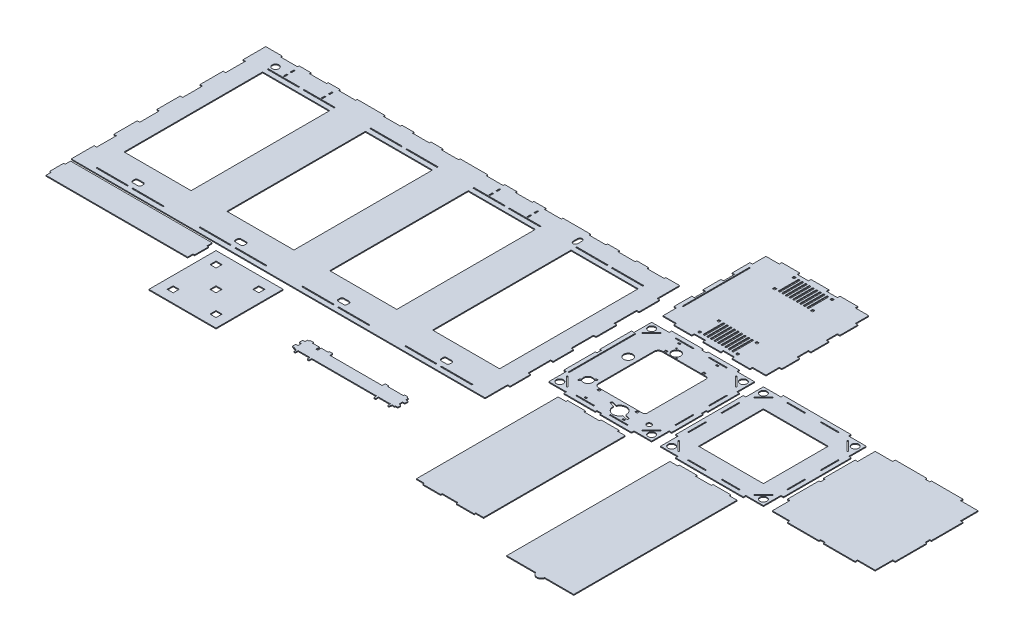
from build123d import *

# Parameters (mm, degrees)
BOSS_EXTRUDE1_DEPTH   = 2.54
SKETCH5_R             = 9.525
SKETCH5_W             = 190.5
SKETCH5_H             = 3.1242
SKETCH5_H_2           = 393.7
CUT_EXTRUDE2_DEPTH    = 788.40676989
BOSS_EXTRUDE2_DEPTH   = 2.54
SKETCH6_W             = 184.15
SKETCH6_H             = 184.15
BOSS_EXTRUDE2_2_DEPTH = 2.54
BOSS_EXTRUDE2_3_DEPTH = 2.54
BOSS_EXTRUDE3_DEPTH   = 2.54
SKETCH8_R             = 10
CUT_EXTRUDE3_DEPTH    = 1467.151394116
SKETCH9_W             = 190.5
SKETCH9_H             = 190.5
SKETCH9_W_2           = 17.272
SKETCH9_H_2           = 17.272
BOSS_EXTRUDE4_DEPTH   = 2.54
SKETCH11_R            = 12.6875032
SKETCH11_R_2          = 1.7054957
SKETCH11_R_3          = 6.747379022
CUT_EXTRUDE4_DEPTH    = 1505.09366579
SKETCH12_W            = 2.921
SKETCH12_H            = 50.8
SKETCH12_W_2          = 50.8
SKETCH12_H_2          = 2.921
CUT_EXTRUDE5_DEPTH    = 1505.09366579
SKETCH13_W            = 2.921
SKETCH13_H            = 190.5
CUT_EXTRUDE6_DEPTH    = 1505.09366579
BOSS_EXTRUDE5_DEPTH   = 2.54
SKETCH14_W            = 2.921
SKETCH14_H            = 190.5
BOSS_EXTRUDE5_2_DEPTH = 2.54
BOSS_EXTRUDE5_3_DEPTH = 2.54
SKETCH15_W            = 48.387
SKETCH15_H            = 4.445
CUT_EXTRUDE7_DEPTH    = 1562.96270761
SKETCH16_W            = 12.7
SKETCH16_H            = 3.1242
BOSS_EXTRUDE6_DEPTH   = 2.54
SKETCH17_W            = 13.335
SKETCH17_H            = 4.445
SKETCH17_W_2          = 4.445
SKETCH17_H_2          = 13.335
CUT_EXTRUDE8_DEPTH    = 1562.96270761
BOSS_EXTRUDE7_DEPTH   = 2.54
CUT_EXTRUDE9_DEPTH    = 1562.96270761
SKETCH21_W            = 6.35
SKETCH21_H            = 6.35
SKETCH21_H_2          = 6.393751892
CUT_EXTRUDE10_DEPTH   = 1562.96270761
SKETCH22_W            = 3.556
SKETCH22_H            = 10
CUT_EXTRUDE11_DEPTH   = 1562.96270761


with BuildPart() as part:
    # Sketch1 → Boss-Extrude1 (new body)
    with BuildSketch(Plane(origin=(0, 0, 0), x_dir=(1, 0, 0), z_dir=(0, 1, 0))):
        Polygon((146.05, 276.225), (438.15, 276.225), (438.15, 212.3694), (445.262, 212.3694), (445.262, 154.0764), (438.15, 154.0764), (438.15, 90.2208), (445.262, 90.2208), (445.262, 31.9278), (438.15, 31.9278), (438.15, -31.9278), (445.262, -31.9278), (445.262, -90.2208), (438.15, -90.2208), (438.15, -154.0764), (445.262, -154.0764), (445.262, -212.3694), (438.15, -212.3694), (438.15, -276.225), (146.05, -276.225), (-146.05, -276.225), (-438.15, -276.225), (-730.25, -276.225), (-737.362, -276.225), (-737.362, -211.1629), (-730.25, -211.1629), (-730.25, -155.2829), (-737.362, -155.2829), (-737.362, -89.0143), (-730.25, -89.0143), (-730.25, -33.1343), (-737.362, -33.1343), (-737.362, 33.1343), (-730.25, 33.1343), (-730.25, 89.0143), (-737.362, 89.0143), (-737.362, 155.2829), (-730.25, 155.2829), (-730.25, 211.1629), (-737.362, 211.1629), (-737.362, 276.225), (-730.25, 276.225), (-438.15, 276.225), (-146.05, 276.225), align=None)
    extrude(amount=BOSS_EXTRUDE1_DEPTH)

    # Sketch5 → Cut-Extrude2 (cut, through all)
    with BuildSketch(Plane(origin=(0, 2.54, 0), x_dir=(1, 0, 0), z_dir=(0, 1, 0))):
        with Locations((-673.862, 240.5634)):
            Circle(SKETCH5_R)
        with Locations((-584.2, -261.9629)):
            Rectangle(SKETCH5_W, SKETCH5_H)
        with Locations((-292.1, -261.9629)):
            Rectangle(SKETCH5_W, SKETCH5_H)
        with Locations((0, -261.9629)):
            Rectangle(SKETCH5_W, SKETCH5_H)
        with Locations((292.1, -261.9629)):
            Rectangle(SKETCH5_W, SKETCH5_H)
        with Locations((-584.2, 12.6492)):
            Rectangle(SKETCH5_W, SKETCH5_H_2)
        with Locations((-292.1, 12.6492)):
            Rectangle(SKETCH5_W, SKETCH5_H_2)
        with Locations((0, 12.6492)):
            Rectangle(SKETCH5_W, SKETCH5_H_2)
        with Locations((292.1, 12.6492)):
            Rectangle(SKETCH5_W, SKETCH5_H_2)
        with Locations((-584.2, 223.7613)):
            Rectangle(SKETCH5_W, SKETCH5_H)
        with Locations((-292.1, 223.7613)):
            Rectangle(SKETCH5_W, SKETCH5_H)
        with Locations((0, 223.7613)):
            Rectangle(SKETCH5_W, SKETCH5_H)
        with Locations((292.1, 223.7613)):
            Rectangle(SKETCH5_W, SKETCH5_H)
        with BuildLine():
            Line((-7.62, -247.7008), (7.62, -247.7008))
            ThreePointArc((7.62, -247.7008), (11.212102448, -246.212902448), (12.7, -242.6208))
            Line((12.7, -242.6208), (12.7, -236.9058))
            ThreePointArc((12.7, -236.9058), (11.212102448, -233.313697552), (7.62, -231.8258))
            Line((7.62, -231.8258), (-7.62, -231.8258))
            ThreePointArc((-7.62, -231.8258), (-11.212102448, -233.313697552), (-12.7, -236.9058))
            Line((-12.7, -236.9058), (-12.7, -242.6208))
            ThreePointArc((-12.7, -242.6208), (-11.212102448, -246.212902448), (-7.62, -247.7008))
        make_face()
        with BuildLine():
            Line((-299.72, -231.8258), (-284.48, -231.8258))
            ThreePointArc((-284.48, -231.8258), (-280.887897552, -233.313697552), (-279.4, -236.9058))
            Line((-279.4, -236.9058), (-279.4, -242.6208))
            ThreePointArc((-279.4, -242.6208), (-280.887897552, -246.212902448), (-284.48, -247.7008))
            Line((-284.48, -247.7008), (-299.72, -247.7008))
            ThreePointArc((-299.72, -247.7008), (-303.312102448, -246.212902448), (-304.8, -242.6208))
            Line((-304.8, -242.6208), (-304.8, -236.9058))
            ThreePointArc((-304.8, -236.9058), (-303.312102448, -233.313697552), (-299.72, -231.8258))
        make_face()
        with BuildLine():
            Line((284.48, -247.7008), (299.72, -247.7008))
            ThreePointArc((299.72, -247.7008), (303.312102448, -246.212902448), (304.8, -242.6208))
            Line((304.8, -242.6208), (304.8, -236.9058))
            ThreePointArc((304.8, -236.9058), (303.312102448, -233.313697552), (299.72, -231.8258))
            Line((299.72, -231.8258), (284.48, -231.8258))
            ThreePointArc((284.48, -231.8258), (280.887897552, -233.313697552), (279.4, -236.9058))
            Line((279.4, -236.9058), (279.4, -242.6208))
            ThreePointArc((279.4, -242.6208), (280.887897552, -246.212902448), (284.48, -247.7008))
        make_face()
        with BuildLine():
            Line((-596.9, -236.9058), (-596.9, -242.6208))
            ThreePointArc((-596.9, -242.6208), (-595.412102448, -246.212902448), (-591.82, -247.7008))
            Line((-591.82, -247.7008), (-576.58, -247.7008))
            ThreePointArc((-576.58, -247.7008), (-572.987897552, -246.212902448), (-571.5, -242.6208))
            Line((-571.5, -242.6208), (-571.5, -236.9058))
            ThreePointArc((-571.5, -236.9058), (-572.987897552, -233.313697552), (-576.58, -231.8258))
            Line((-576.58, -231.8258), (-591.82, -231.8258))
            ThreePointArc((-591.82, -231.8258), (-595.412102448, -233.313697552), (-596.9, -236.9058))
        make_face()
        with BuildLine():
            Line((190.5, 246.9134), (190.5, 234.2134))
            ThreePointArc((190.5, 234.2134), (184.15, 227.8634), (177.8, 234.2134))
            Line((177.8, 234.2134), (177.8, 246.9134))
            ThreePointArc((177.8, 246.9134), (184.15, 253.2634), (190.5, 246.9134))
        make_face()
    extrude(amount=-CUT_EXTRUDE2_DEPTH, mode=Mode.SUBTRACT)

    # Sketch15 → Cut-Extrude7 (cut, through all)
    with BuildSketch(Plane(origin=(0, 2.54, 0), x_dir=(1, 0, 0), z_dir=(0, 1, 0))):
        with Locations((209.55, 274.0025)):
            Rectangle(SKETCH15_W, SKETCH15_H)
        with Locations((374.65, 274.0025)):
            Rectangle(SKETCH15_W, SKETCH15_H)
        with Locations((-82.55, 274.0025)):
            Rectangle(SKETCH15_W, SKETCH15_H)
        with Locations((82.55, 274.0025)):
            Rectangle(SKETCH15_W, SKETCH15_H)
        with Locations((-374.65, 274.0025)):
            Rectangle(SKETCH15_W, SKETCH15_H)
        with Locations((-209.55, 274.0025)):
            Rectangle(SKETCH15_W, SKETCH15_H)
        with Locations((-666.75, 274.0025)):
            Rectangle(SKETCH15_W, SKETCH15_H)
        with Locations((-501.65, 274.0025)):
            Rectangle(SKETCH15_W, SKETCH15_H)
        with Locations((292.1, 274.0025)):
            Rectangle(SKETCH15_W, SKETCH15_H)
        with Locations((0, 274.0025)):
            Rectangle(SKETCH15_W, SKETCH15_H)
        with Locations((-584.2, 274.0025)):
            Rectangle(SKETCH15_W, SKETCH15_H)
        with Locations((-292.1, 274.0025)):
            Rectangle(SKETCH15_W, SKETCH15_H)
    extrude(amount=-CUT_EXTRUDE7_DEPTH, mode=Mode.SUBTRACT)

    # Sketch16 → Boss-Extrude6 (add)
    with BuildSketch(Plane(origin=(0, 2.54, 0), x_dir=(1, 0, 0), z_dir=(0, 1, 0))):
        with Locations((-584.2, 223.7613)):
            Rectangle(SKETCH16_W, SKETCH16_H)
        with Locations((-292.1, 223.7613)):
            Rectangle(SKETCH16_W, SKETCH16_H)
        with Locations((-584.2, -261.9629)):
            Rectangle(SKETCH16_W, SKETCH16_H)
        with Locations((-292.1, -261.9629)):
            Rectangle(SKETCH16_W, SKETCH16_H)
        with Locations((0, 223.7613)):
            Rectangle(SKETCH16_W, SKETCH16_H)
        with Locations((0, -261.9629)):
            Rectangle(SKETCH16_W, SKETCH16_H)
        with Locations((292.1, 223.7613)):
            Rectangle(SKETCH16_W, SKETCH16_H)
        with Locations((292.1, -261.9629)):
            Rectangle(SKETCH16_W, SKETCH16_H)
    extrude(amount=-BOSS_EXTRUDE6_DEPTH)

    # Sketch22 → Cut-Extrude11 (cut, through all)
    with BuildSketch(Plane(origin=(0, 2.54, 0), x_dir=(1, 0, 0), z_dir=(0, 1, 0))):
        with Locations((-638.175, 253.498399878)):
            Rectangle(SKETCH22_W, SKETCH22_H)
        with Locations((-638.175, 233.4984)):
            Rectangle(SKETCH22_W, SKETCH22_H)
        with Locations((-530.225, 233.4984)):
            Rectangle(SKETCH22_W, SKETCH22_H)
        with Locations((-530.225, 253.498399878)):
            Rectangle(SKETCH22_W, SKETCH22_H)
        with Locations((-53.975, 253.498399878)):
            Rectangle(SKETCH22_W, SKETCH22_H)
        with Locations((-53.975, 233.4984)):
            Rectangle(SKETCH22_W, SKETCH22_H)
        with Locations((53.975, 253.498399878)):
            Rectangle(SKETCH22_W, SKETCH22_H)
        with Locations((53.975, 233.4984)):
            Rectangle(SKETCH22_W, SKETCH22_H)
    extrude(amount=-CUT_EXTRUDE11_DEPTH, mode=Mode.SUBTRACT)


with BuildPart() as body_2:
    # Sketch6 → Boss-Extrude2 (new body)
    with BuildSketch(Plane(origin=(0, 0, 0), x_dir=(1, 0, 0), z_dir=(0, 1, 0))):
        Polygon((488.95, 96.139), (488.95, 146.05), (538.861, 146.05), (538.861, 153.162), (731.139, 153.162), (731.139, 146.05), (781.05, 146.05), (781.05, 96.139), (788.162, 96.139), (788.162, -96.139), (781.05, -96.139), (781.05, -146.05), (731.139, -146.05), (731.139, -153.162), (538.861, -153.162), (538.861, -146.05), (488.95, -146.05), (488.95, -96.139), (481.838, -96.139), (481.838, 96.139), align=None)
    extrude(amount=BOSS_EXTRUDE2_DEPTH)


with BuildPart() as body_3:
    # Sketch6 → Boss-Extrude2 2 (new body)
    with BuildSketch(Plane(origin=(0, 0, 0), x_dir=(1, 0, 0), z_dir=(0, 1, 0))):
        Polygon((799.338, 96.139), (799.338, -96.139), (806.45, -96.139), (806.45, -146.05), (856.361, -146.05), (856.361, -153.162), (1048.639, -153.162), (1048.639, -146.05), (1098.55, -146.05), (1098.55, -96.139), (1105.662, -96.139), (1105.662, 96.139), (1098.55, 96.139), (1098.55, 146.05), (1048.639, 146.05), (1048.639, 153.162), (856.361, 153.162), (856.361, 146.05), (806.45, 146.05), (806.45, 96.139), align=None)
        with Locations((952.5, 0)):
            Rectangle(SKETCH6_W, SKETCH6_H, mode=Mode.SUBTRACT)
    extrude(amount=BOSS_EXTRUDE2_2_DEPTH)


with BuildPart() as body_4:
    # Sketch6 → Boss-Extrude2 3 (new body)
    with BuildSketch(Plane(origin=(0, 0, 0), x_dir=(1, 0, 0), z_dir=(0, 1, 0))):
        Polygon((1116.838, 96.139), (1116.838, -96.139), (1123.95, -96.139), (1123.95, -146.05), (1173.861, -146.05), (1173.861, -153.162), (1366.139, -153.162), (1366.139, -146.05), (1416.05, -146.05), (1416.05, -96.139), (1423.162, -96.139), (1423.162, 96.139), (1416.05, 96.139), (1416.05, 146.05), (1366.139, 146.05), (1366.139, 153.162), (1173.861, 153.162), (1173.861, 146.05), (1123.95, 146.05), (1123.95, 96.139), align=None)
    extrude(amount=BOSS_EXTRUDE2_3_DEPTH)


with BuildPart() as body_5:
    # Sketch7 → Boss-Extrude3 (new body)
    with BuildSketch(Plane(origin=(0, 0, 0), x_dir=(1, 0, 0), z_dir=(0, 1, 0))):
        Polygon((-732.917, -282.575), (-330.581, -282.575), (-330.581, -297.815), (-326.136, -297.815), (-326.136, -337.185), (-330.581, -337.185), (-330.581, -352.425), (-732.917, -352.425), (-732.917, -337.185), (-737.362, -337.185), (-737.362, -297.815), (-732.917, -297.815), align=None)
    extrude(amount=BOSS_EXTRUDE3_DEPTH)


with BuildPart() as cut_extrude3_tool:
    # Sketch8 → Cut-Extrude3 (new, through all)
    with BuildSketch(Plane(origin=(0, 2.54, 0), x_dir=(1, 0, 0), z_dir=(0, 1, 0))):
        with Locations((822.165448212, 130.334551788)):
            Circle(SKETCH8_R)
        with Locations((1082.834551788, 130.334551788)):
            Circle(SKETCH8_R)
        with Locations((1082.834551788, -130.334551788)):
            Circle(SKETCH8_R)
        with Locations((822.165448212, -130.334551788)):
            Circle(SKETCH8_R)
        with Locations((504.665448212, 130.334551788)):
            Circle(SKETCH8_R)
        with Locations((765.334551788, 130.334551788)):
            Circle(SKETCH8_R)
        with Locations((765.334551788, -130.334551788)):
            Circle(SKETCH8_R)
        with Locations((504.665448212, -130.334551788)):
            Circle(SKETCH8_R)
        Polygon((500.435115818, -107.624115818), (527.375884182, -134.564884182), (529.585027187, -132.355741176), (502.644258824, -105.414972813), align=None)
        Polygon((529.585027187, 132.355741176), (502.644258824, 105.414972813), (500.435115818, 107.624115818), (527.375884182, 134.564884182), align=None)
        Polygon((767.355741176, 105.414972813), (740.414972813, 132.355741176), (742.624115818, 134.564884182), (769.564884182, 107.624115818), align=None)
        Polygon((740.414972813, -132.355741176), (767.355741176, -105.414972813), (769.564884182, -107.624115818), (742.624115818, -134.564884182), align=None)
        Polygon((817.935115818, -107.624115818), (820.144258824, -105.414972813), (847.085027187, -132.355741176), (844.875884182, -134.564884182), align=None)
        Polygon((820.144258824, 105.414972813), (817.935115818, 107.624115818), (844.875884182, 134.564884182), (847.085027187, 132.355741176), align=None)
        Polygon((1057.914972813, 132.355741176), (1060.124115818, 134.564884182), (1087.064884182, 107.624115818), (1084.855741176, 105.414972813), align=None)
        Polygon((1084.855741176, -105.414972813), (1087.064884182, -107.624115818), (1060.124115818, -134.564884182), (1057.914972813, -132.355741176), align=None)
    extrude(amount=-CUT_EXTRUDE3_DEPTH)


with BuildPart() as body_2_1:
    add(body_2.part)

    # Cut-Extrude3: cut by cut_extrude3_tool
    add(cut_extrude3_tool.part, mode=Mode.SUBTRACT)

    # Sketch11 → Cut-Extrude4 (cut, through all)
    with BuildSketch(Plane(origin=(0, 2.54, 0), x_dir=(1, 0, 0), z_dir=(0, 1, 0))):
        with Locations((540.385, 28.067)):
            Circle(SKETCH11_R)
        with Locations((600.584397, 104.3237436)):
            Circle(SKETCH11_R)
        with Locations((612.380792, 93.3292393)):
            Circle(SKETCH11_R_2)
        with Locations((588.3905174, 117.3172406)):
            Circle(SKETCH11_R_2)
        with Locations((737.057200001, -109.220000002)):
            Circle(SKETCH11_R_3)
        with BuildLine():
            Line((679.001218905, -124.538259876), (690.502378135, -127.619986202))
            ThreePointArc((690.502378135, -127.619986202), (694.235400503, -125.464724733), (692.080139033, -121.731702364))
            Line((692.080139033, -121.731702364), (680.578979804, -118.649976037))
            ThreePointArc((680.578979804, -118.649976037), (679.882033046, -118.172215085), (679.639114424, -117.362906211))
            ThreePointArc((679.639114424, -117.362906211), (665.550382, -98.069523592), (643.702490503, -107.733716851))
            ThreePointArc((643.702490503, -107.733716851), (643.087462368, -108.313139585), (642.245008295, -108.378419327))
            Line((642.245008295, -108.378419327), (630.743849064, -105.296693))
            ThreePointArc((630.743849064, -105.296693), (627.010826696, -107.451954469), (629.166088165, -111.184976837))
            Line((629.166088165, -111.184976837), (640.667247395, -114.266703165))
            ThreePointArc((640.667247395, -114.266703165), (641.364194153, -114.744464117), (641.607112775, -115.553772991))
            ThreePointArc((641.607112775, -115.553772991), (652.618847339, -133.731389412), (673.606119056, -130.381992048))
            ThreePointArc((673.606119056, -130.381992048), (675.79922073, -127.952351108), (677.543736697, -125.182962351))
            ThreePointArc((677.543736697, -125.182962351), (678.158764831, -124.603539618), (679.001218905, -124.538259876))
        make_face()
        with BuildLine():
            Line((551.677072903, -78.533766145), (554.425437911, -75.785401137))
            ThreePointArc((554.425437911, -75.785401137), (554.425437911, -72.193298689), (550.833335463, -72.193298689))
            Line((550.833335463, -72.193298689), (548.084970455, -74.941663697))
            ThreePointArc((548.084970455, -74.941663697), (547.361951275, -75.30152232), (546.568159689, -75.15269396))
            ThreePointArc((546.568159689, -75.15269396), (531.414977451, -77.260920051), (529.30675136, -92.414102289))
            ThreePointArc((529.30675136, -92.414102289), (529.45557972, -93.207893875), (529.095721097, -93.930913055))
            Line((529.095721097, -93.930913055), (526.347356089, -96.679278063))
            ThreePointArc((526.347356089, -96.679278063), (526.347356089, -100.271380511), (529.939458537, -100.271380511))
            Line((529.939458537, -100.271380511), (532.687823545, -97.523015503))
            ThreePointArc((532.687823545, -97.523015503), (533.410842725, -97.16315688), (534.204634311, -97.31198524))
            ThreePointArc((534.204634311, -97.31198524), (549.357816549, -95.203759149), (551.46604264, -80.050576911))
            ThreePointArc((551.46604264, -80.050576911), (551.31721428, -79.256785325), (551.677072903, -78.533766145))
        make_face()
        with BuildLine():
            Line((699.863001735, 90.322743515), (574.863001758, 90.322743515))
            ThreePointArc((574.863001758, 90.322743515), (566.871456828, 87.01253722), (563.561250533, 79.02099229))
            Line((563.561250533, 79.02099229), (563.561250533, -78.979005984))
            ThreePointArc((563.561250533, -78.979005984), (566.871456828, -86.970550914), (574.863001758, -90.280757208))
            Line((574.863001758, -90.280757208), (699.863001735, -90.280757208))
            ThreePointArc((699.863001735, -90.280757208), (704.319011668, -88.435017459), (706.164751417, -83.979007526))
            Line((706.164751417, -83.979007526), (706.164751417, 84.020993832))
            ThreePointArc((706.164751417, 84.020993832), (704.319011668, 88.477003766), (699.863001735, 90.322743515))
        make_face()
    extrude(amount=-CUT_EXTRUDE4_DEPTH, mode=Mode.SUBTRACT)


with BuildPart() as body_3_1:
    add(body_3.part)

    # Cut-Extrude3: cut by cut_extrude3_tool
    add(cut_extrude3_tool.part, mode=Mode.SUBTRACT)


with BuildPart() as body_6:
    # Sketch9 → Boss-Extrude4 (new body)
    with BuildSketch(Plane(origin=(0, 0, 0), x_dir=(1, 0, 0), z_dir=(0, 1, 0))):
        with Locations((-210.886, -391.475)):
            Rectangle(SKETCH9_W, SKETCH9_H)
        with Locations((-210.886, -391.475)):
            Rectangle(SKETCH9_W_2, SKETCH9_H_2, mode=Mode.SUBTRACT)
        with Locations((-271.784727194, -330.576272806)):
            Rectangle(SKETCH9_W_2, SKETCH9_H_2, mode=Mode.SUBTRACT)
        with Locations((-271.784727194, -452.373727194)):
            Rectangle(SKETCH9_W_2, SKETCH9_H_2, mode=Mode.SUBTRACT)
        with Locations((-149.987272806, -452.373727194)):
            Rectangle(SKETCH9_W_2, SKETCH9_H_2, mode=Mode.SUBTRACT)
        with Locations((-149.987272806, -330.576272806)):
            Rectangle(SKETCH9_W_2, SKETCH9_H_2, mode=Mode.SUBTRACT)
    extrude(amount=BOSS_EXTRUDE4_DEPTH)


with BuildPart() as cut_extrude5_tool:
    # Sketch12 → Cut-Extrude5 (new, through all)
    with BuildSketch(Plane(origin=(0, 2.54, 0), x_dir=(1, 0, 0), z_dir=(0, 1, 0))):
        with Locations((494.0935, -47.621851794)):
            Rectangle(SKETCH12_W, SKETCH12_H)
        with Locations((494.0935, 47.628148206)):
            Rectangle(SKETCH12_W, SKETCH12_H)
        with Locations((682.628148206, 140.9065)):
            Rectangle(SKETCH12_W_2, SKETCH12_H_2)
        with Locations((587.378148206, 140.9065)):
            Rectangle(SKETCH12_W_2, SKETCH12_H_2)
        with Locations((775.9065, -47.628148206)):
            Rectangle(SKETCH12_W, SKETCH12_H)
        with Locations((775.9065, 47.621851794)):
            Rectangle(SKETCH12_W, SKETCH12_H)
        with Locations((587.371851794, -140.9065)):
            Rectangle(SKETCH12_W_2, SKETCH12_H_2)
        with Locations((682.621851794, -140.9065)):
            Rectangle(SKETCH12_W_2, SKETCH12_H_2)
        with Locations((811.5935, 47.628148206)):
            Rectangle(SKETCH12_W, SKETCH12_H)
        with Locations((811.5935, -47.621851794)):
            Rectangle(SKETCH12_W, SKETCH12_H)
        with Locations((1000.128148206, 140.9065)):
            Rectangle(SKETCH12_W_2, SKETCH12_H_2)
        with Locations((904.878148206, 140.9065)):
            Rectangle(SKETCH12_W_2, SKETCH12_H_2)
        with Locations((1093.4065, -47.628148206)):
            Rectangle(SKETCH12_W, SKETCH12_H)
        with Locations((1093.4065, 47.621851794)):
            Rectangle(SKETCH12_W, SKETCH12_H)
        with Locations((904.871851794, -140.9065)):
            Rectangle(SKETCH12_W_2, SKETCH12_H_2)
        with Locations((1000.121851794, -140.9065)):
            Rectangle(SKETCH12_W_2, SKETCH12_H_2)
    extrude(amount=-CUT_EXTRUDE5_DEPTH)


with BuildPart() as body_2_2:
    add(body_2_1.part)

    # Cut-Extrude5: cut by cut_extrude5_tool
    add(cut_extrude5_tool.part, mode=Mode.SUBTRACT)

    # Sketch13 → Cut-Extrude6 (cut, through all)
    with BuildSketch(Plane(origin=(0, 2.54, 0), x_dir=(1, 0, 0), z_dir=(0, 1, 0))):
        with Locations((494.0935, 0.003148206)):
            Rectangle(SKETCH13_W, SKETCH13_H)
    extrude(amount=-CUT_EXTRUDE6_DEPTH, mode=Mode.SUBTRACT)


with BuildPart() as body_3_2:
    add(body_3_1.part)

    # Cut-Extrude5: cut by cut_extrude5_tool
    add(cut_extrude5_tool.part, mode=Mode.SUBTRACT)


with BuildPart() as body_7:
    # Sketch14 → Boss-Extrude5 (new body)
    with BuildSketch(Plane(origin=(0, 0, 0), x_dir=(1, 0, 0), z_dir=(0, 1, 0))):
        Polygon((539.746851794, -170.307), (561.971851794, -170.307), (561.971851794, -165.862), (612.771851794, -165.862), (612.771851794, -170.307), (657.221851794, -170.307), (657.221851794, -165.862), (708.021851794, -165.862), (708.021851794, -170.307), (730.246851794, -170.307), (730.246851794, -572.643), (708.021851794, -572.643), (708.021851794, -577.088), (657.221851794, -577.088), (657.221851794, -572.643), (612.771851794, -572.643), (612.771851794, -577.088), (561.971851794, -577.088), (561.971851794, -572.643), (539.746851794, -572.643), align=None)
    extrude(amount=BOSS_EXTRUDE5_DEPTH)


with BuildPart() as body_8:
    # Sketch14 → Boss-Extrude5 2 (new body)
    with BuildSketch(Plane(origin=(0, 0, 0), x_dir=(1, 0, 0), z_dir=(0, 1, 0))):
        Polygon((660.4, 470.662), (692.15, 470.662), (692.15, 477.774), (742.95, 477.774), (742.95, 470.662), (781.05, 470.662), (781.05, 432.562), (788.162, 432.562), (788.162, 381.762), (781.05, 381.762), (781.05, 350.012), (788.162, 350.012), (788.162, 299.212), (781.05, 299.212), (781.05, 267.462), (788.162, 267.462), (788.162, 216.662), (781.05, 216.662), (781.05, 178.562), (742.95, 178.562), (742.95, 171.45), (692.15, 171.45), (692.15, 178.562), (660.4, 178.562), (660.4, 171.45), (609.6, 171.45), (609.6, 178.562), (577.85, 178.562), (577.85, 171.45), (527.05, 171.45), (527.05, 178.562), (488.95, 178.562), (488.95, 216.662), (481.838, 216.662), (481.838, 267.462), (488.95, 267.462), (488.95, 299.212), (481.838, 299.212), (481.838, 350.012), (488.95, 350.012), (488.95, 381.762), (481.838, 381.762), (481.838, 432.562), (488.95, 432.562), (488.95, 470.662), (527.05, 470.662), (527.05, 477.774), (577.85, 477.774), (577.85, 470.662), (609.6, 470.662), (609.6, 477.774), (660.4, 477.774), align=None)
        with BuildLine():
            Line((632.46, 244.9068), (632.46, 190.9318))
            ThreePointArc((632.46, 190.9318), (635, 188.3918), (637.54, 190.9318))
            Line((637.54, 190.9318), (637.54, 244.9068))
            ThreePointArc((637.54, 244.9068), (635, 247.4468), (632.46, 244.9068))
        make_face(mode=Mode.SUBTRACT)
        with BuildLine():
            Line((632.46, 404.3172), (632.46, 458.2922))
            ThreePointArc((632.46, 458.2922), (635, 460.8322), (637.54, 458.2922))
            Line((637.54, 458.2922), (637.54, 404.3172))
            ThreePointArc((637.54, 404.3172), (635, 401.7772), (632.46, 404.3172))
        make_face(mode=Mode.SUBTRACT)
        with BuildLine():
            Line((642.62, 404.3172), (642.62, 458.2922))
            ThreePointArc((642.62, 458.2922), (645.16, 460.8322), (647.7, 458.2922))
            Line((647.7, 458.2922), (647.7, 404.3172))
            ThreePointArc((647.7, 404.3172), (645.16, 401.7772), (642.62, 404.3172))
        make_face(mode=Mode.SUBTRACT)
        with BuildLine():
            Line((642.62, 244.9068), (642.62, 190.9318))
            ThreePointArc((642.62, 190.9318), (645.16, 188.3918), (647.7, 190.9318))
            Line((647.7, 190.9318), (647.7, 244.9068))
            ThreePointArc((647.7, 244.9068), (645.16, 247.4468), (642.62, 244.9068))
        make_face(mode=Mode.SUBTRACT)
        with BuildLine():
            Line((652.78, 404.3172), (652.78, 458.2922))
            ThreePointArc((652.78, 458.2922), (655.32, 460.8322), (657.86, 458.2922))
            Line((657.86, 458.2922), (657.86, 404.3172))
            ThreePointArc((657.86, 404.3172), (655.32, 401.7772), (652.78, 404.3172))
        make_face(mode=Mode.SUBTRACT)
        with BuildLine():
            Line((652.78, 244.9068), (652.78, 190.9318))
            ThreePointArc((652.78, 190.9318), (655.32, 188.3918), (657.86, 190.9318))
            Line((657.86, 190.9318), (657.86, 244.9068))
            ThreePointArc((657.86, 244.9068), (655.32, 247.4468), (652.78, 244.9068))
        make_face(mode=Mode.SUBTRACT)
        with BuildLine():
            Line((662.94, 404.3172), (662.94, 458.2922))
            ThreePointArc((662.94, 458.2922), (665.48, 460.8322), (668.02, 458.2922))
            Line((668.02, 458.2922), (668.02, 404.3172))
            ThreePointArc((668.02, 404.3172), (665.48, 401.7772), (662.94, 404.3172))
        make_face(mode=Mode.SUBTRACT)
        with BuildLine():
            Line((662.94, 244.9068), (662.94, 190.9318))
            ThreePointArc((662.94, 190.9318), (665.48, 188.3918), (668.02, 190.9318))
            Line((668.02, 190.9318), (668.02, 244.9068))
            ThreePointArc((668.02, 244.9068), (665.48, 247.4468), (662.94, 244.9068))
        make_face(mode=Mode.SUBTRACT)
        with BuildLine():
            Line((673.1, 404.3172), (673.1, 458.2922))
            ThreePointArc((673.1, 458.2922), (675.64, 460.8322), (678.18, 458.2922))
            Line((678.18, 458.2922), (678.18, 404.3172))
            ThreePointArc((678.18, 404.3172), (675.64, 401.7772), (673.1, 404.3172))
        make_face(mode=Mode.SUBTRACT)
        with BuildLine():
            Line((673.1, 244.9068), (673.1, 190.9318))
            ThreePointArc((673.1, 190.9318), (675.64, 188.3918), (678.18, 190.9318))
            Line((678.18, 190.9318), (678.18, 244.9068))
            ThreePointArc((678.18, 244.9068), (675.64, 247.4468), (673.1, 244.9068))
        make_face(mode=Mode.SUBTRACT)
        with BuildLine():
            Line((622.3, 404.3172), (622.3, 458.2922))
            ThreePointArc((622.3, 458.2922), (624.84, 460.8322), (627.38, 458.2922))
            Line((627.38, 458.2922), (627.38, 404.3172))
            ThreePointArc((627.38, 404.3172), (624.84, 401.7772), (622.3, 404.3172))
        make_face(mode=Mode.SUBTRACT)
        with BuildLine():
            Line((622.3, 244.9068), (622.3, 190.9318))
            ThreePointArc((622.3, 190.9318), (624.84, 188.3918), (627.38, 190.9318))
            Line((627.38, 190.9318), (627.38, 244.9068))
            ThreePointArc((627.38, 244.9068), (624.84, 247.4468), (622.3, 244.9068))
        make_face(mode=Mode.SUBTRACT)
        with BuildLine():
            Line((612.14, 404.3172), (612.14, 458.2922))
            ThreePointArc((612.14, 458.2922), (614.68, 460.8322), (617.22, 458.2922))
            Line((617.22, 458.2922), (617.22, 404.3172))
            ThreePointArc((617.22, 404.3172), (614.68, 401.7772), (612.14, 404.3172))
        make_face(mode=Mode.SUBTRACT)
        with BuildLine():
            Line((612.14, 244.9068), (612.14, 190.9318))
            ThreePointArc((612.14, 190.9318), (614.68, 188.3918), (617.22, 190.9318))
            Line((617.22, 190.9318), (617.22, 244.9068))
            ThreePointArc((617.22, 244.9068), (614.68, 247.4468), (612.14, 244.9068))
        make_face(mode=Mode.SUBTRACT)
        with BuildLine():
            Line((601.98, 404.3172), (601.98, 458.2922))
            ThreePointArc((601.98, 458.2922), (604.52, 460.8322), (607.06, 458.2922))
            Line((607.06, 458.2922), (607.06, 404.3172))
            ThreePointArc((607.06, 404.3172), (604.52, 401.7772), (601.98, 404.3172))
        make_face(mode=Mode.SUBTRACT)
        with BuildLine():
            Line((601.98, 244.9068), (601.98, 190.9318))
            ThreePointArc((601.98, 190.9318), (604.52, 188.3918), (607.06, 190.9318))
            Line((607.06, 190.9318), (607.06, 244.9068))
            ThreePointArc((607.06, 244.9068), (604.52, 247.4468), (601.98, 244.9068))
        make_face(mode=Mode.SUBTRACT)
        with BuildLine():
            Line((591.82, 404.3172), (591.82, 458.2922))
            ThreePointArc((591.82, 458.2922), (594.36, 460.8322), (596.9, 458.2922))
            Line((596.9, 458.2922), (596.9, 404.3172))
            ThreePointArc((596.9, 404.3172), (594.36, 401.7772), (591.82, 404.3172))
        make_face(mode=Mode.SUBTRACT)
        with BuildLine():
            Line((591.82, 244.9068), (591.82, 190.9318))
            ThreePointArc((591.82, 190.9318), (594.36, 188.3918), (596.9, 190.9318))
            Line((596.9, 190.9318), (596.9, 244.9068))
            ThreePointArc((596.9, 244.9068), (594.36, 247.4468), (591.82, 244.9068))
        make_face(mode=Mode.SUBTRACT)
        with Locations((494.0935, 324.612)):
            Rectangle(SKETCH14_W, SKETCH14_H, mode=Mode.SUBTRACT)
    extrude(amount=BOSS_EXTRUDE5_2_DEPTH)

    # Sketch21 → Cut-Extrude10 (cut, through all)
    with BuildSketch(Plane(origin=(0, 2.54, 0), x_dir=(1, 0, 0), z_dir=(0, 1, 0))):
        with Locations((581.058579269, 403.617416133)):
            Rectangle(SKETCH21_W, SKETCH21_H)
        with Locations((581.058579269, 458.481416133)):
            Rectangle(SKETCH21_W, SKETCH21_H)
        with Locations((689.008579269, 458.481416133)):
            Rectangle(SKETCH21_W, SKETCH21_H)
        with Locations((689.008579269, 403.639292079)):
            Rectangle(SKETCH21_W, SKETCH21_H_2)
        with Locations((581.058579269, 190.257416133)):
            Rectangle(SKETCH21_W, SKETCH21_H)
        with Locations((581.058579269, 245.121416133)):
            Rectangle(SKETCH21_W, SKETCH21_H)
        with Locations((689.008579269, 245.121416133)):
            Rectangle(SKETCH21_W, SKETCH21_H)
        with Locations((689.008579269, 190.279292079)):
            Rectangle(SKETCH21_W, SKETCH21_H_2)
    extrude(amount=-CUT_EXTRUDE10_DEPTH, mode=Mode.SUBTRACT)


with BuildPart() as body_9:
    # Sketch14 → Boss-Extrude5 3 (new body)
    with BuildSketch(Plane(origin=(0, 0, 0), x_dir=(1, 0, 0), z_dir=(0, 1, 0))):
        with BuildLine():
            Line((857.25, -170.307), (879.471851794, -170.307))
            Line((879.471851794, -170.307), (879.471851794, -165.862))
            Line((879.471851794, -165.862), (930.271851794, -165.862))
            Line((930.271851794, -165.862), (930.271851794, -170.307))
            Line((930.271851794, -170.307), (974.721851794, -170.307))
            Line((974.721851794, -170.307), (974.721851794, -165.862))
            Line((974.721851794, -165.862), (1025.521851794, -165.862))
            Line((1025.521851794, -165.862), (1025.521851794, -170.307))
            Line((1025.521851794, -170.307), (1047.75, -170.307))
            Line((1047.75, -170.307), (1047.75, -633.857))
            Line((1047.75, -633.857), (965.2, -633.857))
            ThreePointArc((965.2, -633.857), (952.5, -643.685458995), (939.8, -633.857))
            Line((939.8, -633.857), (857.25, -633.857))
            Line((857.25, -633.857), (857.25, -170.307))
        make_face()
    extrude(amount=BOSS_EXTRUDE5_3_DEPTH)


with BuildPart() as cut_extrude8_tool:
    # Sketch17 → Cut-Extrude8 (new, through all)
    with BuildSketch(Plane(origin=(0, 2.54, 0), x_dir=(1, 0, 0), z_dir=(0, 1, 0))):
        with Locations((635, 150.9395)):
            Rectangle(SKETCH17_W, SKETCH17_H)
        with Locations((635, -150.9395)):
            Rectangle(SKETCH17_W, SKETCH17_H)
        with Locations((484.0605, 0)):
            Rectangle(SKETCH17_W_2, SKETCH17_H_2)
        with Locations((785.9395, 0)):
            Rectangle(SKETCH17_W_2, SKETCH17_H_2)
        with Locations((1119.0605, 0)):
            Rectangle(SKETCH17_W_2, SKETCH17_H_2)
        with Locations((1270, -150.9395)):
            Rectangle(SKETCH17_W, SKETCH17_H)
        with Locations((1420.9395, 0)):
            Rectangle(SKETCH17_W_2, SKETCH17_H_2)
        with Locations((1270, 150.9395)):
            Rectangle(SKETCH17_W, SKETCH17_H)
    extrude(amount=-CUT_EXTRUDE8_DEPTH)


with BuildPart() as body_2_3:
    add(body_2_2.part)

    # Cut-Extrude8: cut by cut_extrude8_tool
    add(cut_extrude8_tool.part, mode=Mode.SUBTRACT)

    # Sketch20 → Cut-Extrude9 (cut, through all)
    with BuildSketch(Plane(origin=(0, 2.54, 0), x_dir=(1, 0, 0), z_dir=(0, 1, 0))):
        with BuildLine():
            ThreePointArc((690.838600495, -98.036214492), (691.399866502, -98.268698484), (691.961132509, -98.036214492))
            Line((691.961132509, -98.036214492), (691.961132509, -92.808743325))
            ThreePointArc((691.961132509, -92.808743325), (691.96113251, -91.68621131), (690.838600495, -91.68621131))
            Line((690.838600495, -91.68621131), (686.733661345, -91.68621131))
            ThreePointArc((686.733661345, -91.68621131), (685.611129329, -91.68621131), (685.61112933, -92.808743325))
            Line((685.61112933, -92.808743325), (685.61112933, -96.913682477))
            ThreePointArc((685.61112933, -96.913682477), (685.61112933, -98.036214492), (686.733661345, -98.036214492))
            Line((686.733661345, -98.036214492), (690.838600495, -98.036214492))
        make_face()
        with BuildLine():
            Line((691.961132509, -135.16305324), (691.961132509, -131.056219122))
            ThreePointArc((691.961132509, -131.056219122), (691.399866502, -130.82373513), (690.838600494, -131.056219122))
            Line((690.838600494, -131.056219122), (686.733665067, -131.056219122))
            ThreePointArc((686.733665067, -131.056219122), (685.61113305, -131.056219122), (685.61113305, -132.178751139))
            Line((685.61113305, -132.178751139), (685.61113305, -135.16305324))
            Line((685.61113305, -135.16305324), (691.961132509, -135.16305324))
        make_face()
        with BuildLine():
            ThreePointArc((685.61112933, 92.558299944), (685.61112933, 91.435767929), (686.733661345, 91.43576793))
            Line((686.733661345, 91.43576793), (690.838600495, 91.43576793))
            ThreePointArc((690.838600495, 91.43576793), (691.961132509, 91.43576793), (691.961132509, 92.558299944))
            Line((691.961132509, 92.558299944), (691.961132509, 96.663239097))
            ThreePointArc((691.961132509, 96.663239097), (691.96113251, 97.785771111), (690.838600495, 97.785771112))
            Line((690.838600495, 97.785771112), (686.733661345, 97.785771111))
            ThreePointArc((686.733661345, 97.785771111), (685.61112933, 97.785771112), (685.61112933, 96.663239097))
            Line((685.61112933, 96.663239097), (685.61112933, 92.558299944))
        make_face()
        with BuildLine():
            ThreePointArc((577.661127376, 92.558299944), (577.661127376, 91.43576793), (578.78365939, 91.43576793))
            Line((578.78365939, 91.43576793), (582.88859854, 91.43576793))
            ThreePointArc((582.88859854, 91.43576793), (584.011130554, 91.435767929), (584.011130554, 92.558299944))
            Line((584.011130554, 92.558299944), (584.011130555, 96.663239097))
            ThreePointArc((584.011130555, 96.663239097), (584.011130555, 97.785771112), (582.88859854, 97.785771112))
            Line((582.88859854, 97.785771112), (578.78365939, 97.785771112))
            ThreePointArc((578.78365939, 97.785771112), (577.661127375, 97.785771111), (577.661127376, 96.663239097))
            Line((577.661127376, 96.663239097), (577.661127376, 92.558299944))
        make_face()
        with BuildLine():
            ThreePointArc((584.011130554, -92.808743325), (584.011130555, -91.68621131), (582.88859854, -91.68621131))
            Line((582.88859854, -91.68621131), (578.78365939, -91.686211309))
            ThreePointArc((578.78365939, -91.686211309), (577.661127375, -91.68621131), (577.661127376, -92.808743325))
            Line((577.661127376, -92.808743325), (577.661127376, -96.913682477))
            ThreePointArc((577.661127376, -96.913682477), (577.661127376, -98.036214492), (578.78365939, -98.036214492))
            Line((578.78365939, -98.036214492), (582.88859854, -98.036214492))
            ThreePointArc((582.88859854, -98.036214492), (584.011130554, -98.036214492), (584.011130554, -96.913682477))
            Line((584.011130554, -96.913682477), (584.011130554, -92.808743325))
        make_face()
        with BuildLine():
            Line((691.961132509, 134.912609808), (685.61113305, 134.912609808))
            Line((685.61113305, 134.912609808), (685.61113305, 131.928307758))
            ThreePointArc((685.61113305, 131.928307758), (685.611133051, 130.805775742), (686.733665067, 130.805775743))
            Line((686.733665067, 130.805775743), (690.838600495, 130.805775743))
            ThreePointArc((690.838600495, 130.805775743), (691.961132509, 130.805775743), (691.961132509, 131.928307758))
            Line((691.961132509, 131.928307758), (691.961132509, 134.912609808))
        make_face()
        with BuildLine():
            Line((584.011130553, 134.912609808), (577.661131097, 134.912609808))
            Line((577.661131097, 134.912609808), (577.661131097, 131.928307758))
            ThreePointArc((577.661131097, 131.928307758), (577.661131098, 130.805775742), (578.783663114, 130.805775743))
            Line((578.783663114, 130.805775743), (582.888598541, 130.805775743))
            ThreePointArc((582.888598541, 130.805775743), (584.011130556, 130.805775746), (584.011130553, 131.92830776))
            Line((584.011130553, 131.92830776), (584.011130553, 134.912609808))
        make_face()
        with BuildLine():
            Line((584.011130553, -135.16305324), (584.011130553, -132.178751141))
            ThreePointArc((584.011130553, -132.178751141), (584.011130557, -131.056219125), (582.888598541, -131.056219122))
            Line((582.888598541, -131.056219122), (578.783663113, -131.056219122))
            ThreePointArc((578.783663113, -131.056219122), (577.661131096, -131.056219122), (577.661131096, -132.178751139))
            Line((577.661131096, -132.178751139), (577.661131096, -135.16305324))
            Line((577.661131096, -135.16305324), (584.011130553, -135.16305324))
        make_face()
    extrude(amount=-CUT_EXTRUDE9_DEPTH, mode=Mode.SUBTRACT)


with BuildPart() as body_4_1:
    add(body_4.part)

    # Cut-Extrude8: cut by cut_extrude8_tool
    add(cut_extrude8_tool.part, mode=Mode.SUBTRACT)


with BuildPart() as body_10:
    # Sketch19 → Boss-Extrude7 (new body)
    with BuildSketch(Plane(origin=(0, 0, 0), x_dir=(1, 0, 0), z_dir=(0, 1, 0))):
        with BuildLine():
            Line((321.960774785, -433.627700402), (322.754524785, -432.833950402))
            Line((322.754524785, -432.833950402), (322.754524785, -428.400232419))
            ThreePointArc((322.754524785, -428.400232419), (322.754524784, -427.277700403), (323.877056799, -427.277700402))
            Line((323.877056799, -427.277700402), (324.777101817, -427.277700402))
            Line((324.777101817, -427.277700402), (324.777101817, -426.825432419))
            ThreePointArc((324.777101817, -426.825432419), (324.777101815, -425.702900403), (325.899633831, -425.702900402))
            Line((325.899633831, -425.702900402), (331.127101817, -425.702900402))
            Line((331.127101817, -425.702900402), (331.127101817, -424.750232419))
            ThreePointArc((331.127101817, -424.750232419), (331.127101815, -423.627700403), (332.249633831, -423.627700402))
            Line((332.249633831, -423.627700402), (335.889601817, -423.627700402))
            Line((335.889601817, -423.627700402), (337.477101817, -422.040200402))
            Line((337.477101817, -422.040200402), (337.477101817, -415.215200402))
            Line((337.477101817, -415.215200402), (335.889601817, -413.627700402))
            Line((335.889601817, -413.627700402), (332.249633831, -413.627700402))
            ThreePointArc((332.249633831, -413.627700402), (331.127101817, -413.627700402), (331.127101817, -412.505168387))
            Line((331.127101817, -412.505168387), (331.127101817, -404.750232419))
            ThreePointArc((331.127101817, -404.750232419), (331.127101815, -403.627700403), (332.249633831, -403.627700402))
            Line((332.249633831, -403.627700402), (335.889601817, -403.627700402))
            Line((335.889601817, -403.627700402), (337.477101817, -402.040200402))
            Line((337.477101817, -402.040200402), (337.477101817, -395.215200402))
            Line((337.477101817, -395.215200402), (335.889601817, -393.627700402))
            Line((335.889601817, -393.627700402), (332.249633831, -393.627700402))
            ThreePointArc((332.249633831, -393.627700402), (331.127101817, -393.627700402), (331.127101817, -392.505168387))
            Line((331.127101817, -392.505168387), (331.127101817, -386.802700402))
            Line((331.127101817, -386.802700402), (327.724633831, -386.802700402))
            ThreePointArc((327.724633831, -386.802700402), (326.602101817, -386.802700402), (326.602101817, -385.680168387))
            Line((326.602101817, -385.680168387), (326.602101817, -384.421450402))
            Line((326.602101817, -384.421450402), (325.808351817, -383.627700402))
            Line((325.808351817, -383.627700402), (317.395851817, -383.627700402))
            Line((317.395851817, -383.627700402), (316.602101817, -384.421450402))
            Line((316.602101817, -384.421450402), (316.602101817, -385.680168387))
            ThreePointArc((316.602101817, -385.680168387), (316.602101817, -386.802700402), (315.479569802, -386.802700402))
            Line((315.479569802, -386.802700402), (272.860633831, -386.802700402))
            ThreePointArc((272.860633831, -386.802700402), (271.738101817, -386.802700402), (271.738101817, -385.680168387))
            Line((271.738101817, -385.680168387), (271.738101817, -384.421450402))
            Line((271.738101817, -384.421450402), (270.944351817, -383.627700402))
            Line((270.944351817, -383.627700402), (262.531851817, -383.627700402))
            Line((262.531851817, -383.627700402), (261.738101817, -384.421450402))
            Line((261.738101817, -384.421450402), (261.738101817, -391.052368387))
            ThreePointArc((261.738101817, -391.052368387), (261.738101817, -392.174900402), (260.615569802, -392.174900402))
            Line((260.615569802, -392.174900402), (114.338633835, -392.174900402))
            ThreePointArc((114.338633835, -392.174900402), (113.216101819, -392.174900403), (113.216101818, -391.052368387))
            Line((113.216101818, -391.052368387), (113.216101818, -384.421450402))
            Line((113.216101818, -384.421450402), (112.422351818, -383.627700402))
            Line((112.422351818, -383.627700402), (104.009851818, -383.627700402))
            Line((104.009851818, -383.627700402), (103.216101818, -384.421450402))
            Line((103.216101818, -384.421450402), (103.216101818, -385.680168387))
            ThreePointArc((103.216101818, -385.680168387), (103.216101818, -386.802700402), (102.093569803, -386.802700402))
            Line((102.093569803, -386.802700402), (83.284101819, -386.802700402))
            Line((83.284101819, -386.802700402), (83.284101819, -395.680168387))
            ThreePointArc((83.284101819, -395.680168387), (83.284101819, -396.802700402), (82.161569805, -396.802700402))
            Line((82.161569805, -396.802700402), (79.406633834, -396.802700402))
            ThreePointArc((79.406633834, -396.802700402), (78.284101819, -396.802700402), (78.284101819, -395.680168387))
            Line((78.284101819, -395.680168387), (78.284101819, -386.802700402))
            Line((78.284101819, -386.802700402), (59.474633835, -386.802700402))
            ThreePointArc((59.474633835, -386.802700402), (58.352101819, -386.802700403), (58.352101818, -385.680168387))
            Line((58.352101818, -385.680168387), (58.352101818, -384.421450402))
            Line((58.352101818, -384.421450402), (57.558351818, -383.627700402))
            Line((57.558351818, -383.627700402), (49.145851818, -383.627700402))
            Line((49.145851818, -383.627700402), (48.352101818, -384.421450402))
            Line((48.352101818, -384.421450402), (48.352101818, -385.680168387))
            ThreePointArc((48.352101818, -385.680168387), (48.352101818, -386.802700402), (47.229569803, -386.802700402))
            Line((47.229569803, -386.802700402), (43.827101818, -386.802700402))
            Line((43.827101818, -386.802700402), (43.827101818, -392.505168387))
            ThreePointArc((43.827101818, -392.505168387), (43.827101818, -393.627700402), (42.704569803, -393.627700402))
            Line((42.704569803, -393.627700402), (39.064601818, -393.627700402))
            Line((39.064601818, -393.627700402), (37.477101818, -395.215200402))
            Line((37.477101818, -395.215200402), (37.477101818, -402.040200402))
            Line((37.477101818, -402.040200402), (39.064601818, -403.627700402))
            Line((39.064601818, -403.627700402), (42.704569803, -403.627700402))
            ThreePointArc((42.704569803, -403.627700402), (43.827101819, -403.627700403), (43.827101818, -404.750232419))
            Line((43.827101818, -404.750232419), (43.827101818, -412.505168387))
            ThreePointArc((43.827101818, -412.505168387), (43.827101818, -413.627700402), (42.704569803, -413.627700402))
            Line((42.704569803, -413.627700402), (39.064601818, -413.627700402))
            Line((39.064601818, -413.627700402), (37.477101818, -415.215200402))
            Line((37.477101818, -415.215200402), (37.477101818, -422.040200402))
            Line((37.477101818, -422.040200402), (39.064601818, -423.627700402))
            Line((39.064601818, -423.627700402), (42.704569803, -423.627700402))
            ThreePointArc((42.704569803, -423.627700402), (43.827101819, -423.627700403), (43.827101818, -424.750232419))
            Line((43.827101818, -424.750232419), (43.827101818, -425.702900402))
            Line((43.827101818, -425.702900402), (49.054569803, -425.702900402))
            ThreePointArc((49.054569803, -425.702900402), (50.177101819, -425.702900403), (50.177101818, -426.825432419))
            Line((50.177101818, -426.825432419), (50.177101818, -427.277700402))
            Line((50.177101818, -427.277700402), (51.175329776, -427.277700402))
            ThreePointArc((51.175329776, -427.277700402), (52.297861793, -427.277700402), (52.297861793, -428.400232419))
            Line((52.297861793, -428.400232419), (52.297861793, -432.833950402))
            Line((52.297861793, -432.833950402), (53.091611793, -433.627700402))
            Line((53.091611793, -433.627700402), (55.733351818, -433.627700402))
            Line((55.733351818, -433.627700402), (56.527101818, -432.833950402))
            Line((56.527101818, -432.833950402), (56.527101818, -426.825432419))
            ThreePointArc((56.527101818, -426.825432419), (56.527101817, -425.702900403), (57.649633832, -425.702900402))
            Line((57.649633832, -425.702900402), (89.099569805, -425.702900402))
            ThreePointArc((89.099569805, -425.702900402), (90.22210182, -425.702900403), (90.222101819, -426.825432419))
            Line((90.222101819, -426.825432419), (90.222101819, -432.833950402))
            Line((90.222101819, -432.833950402), (91.015851819, -433.627700402))
            Line((91.015851819, -433.627700402), (94.428351819, -433.627700402))
            Line((94.428351819, -433.627700402), (95.222101819, -432.833950402))
            Line((95.222101819, -432.833950402), (95.222101819, -426.825432419))
            ThreePointArc((95.222101819, -426.825432419), (95.222101818, -425.702900403), (96.344633834, -425.702900402))
            Line((96.344633834, -425.702900402), (278.609569803, -425.702900402))
            ThreePointArc((278.609569803, -425.702900402), (279.732101819, -425.702900403), (279.732101818, -426.825432419))
            Line((279.732101818, -426.825432419), (279.732101818, -432.833950402))
            Line((279.732101818, -432.833950402), (280.525851818, -433.627700402))
            Line((280.525851818, -433.627700402), (283.938351818, -433.627700402))
            Line((283.938351818, -433.627700402), (284.732101818, -432.833950402))
            Line((284.732101818, -432.833950402), (284.732101818, -426.825432419))
            ThreePointArc((284.732101818, -426.825432419), (284.732101817, -425.702900403), (285.854633832, -425.702900402))
            Line((285.854633832, -425.702900402), (317.304569802, -425.702900402))
            ThreePointArc((317.304569802, -425.702900402), (318.427101818, -425.702900403), (318.427101817, -426.825432419))
            Line((318.427101817, -426.825432419), (318.427101817, -432.833950402))
            Line((318.427101817, -432.833950402), (319.220851817, -433.627700402))
            Line((319.220851817, -433.627700402), (321.960774785, -433.627700402))
        make_face()
    extrude(amount=BOSS_EXTRUDE7_DEPTH)


solid = Compound([part.part, body_5.part, body_6.part, body_3_2.part, body_7.part, body_8.part, body_9.part, body_2_3.part, body_4_1.part, body_10.part])
